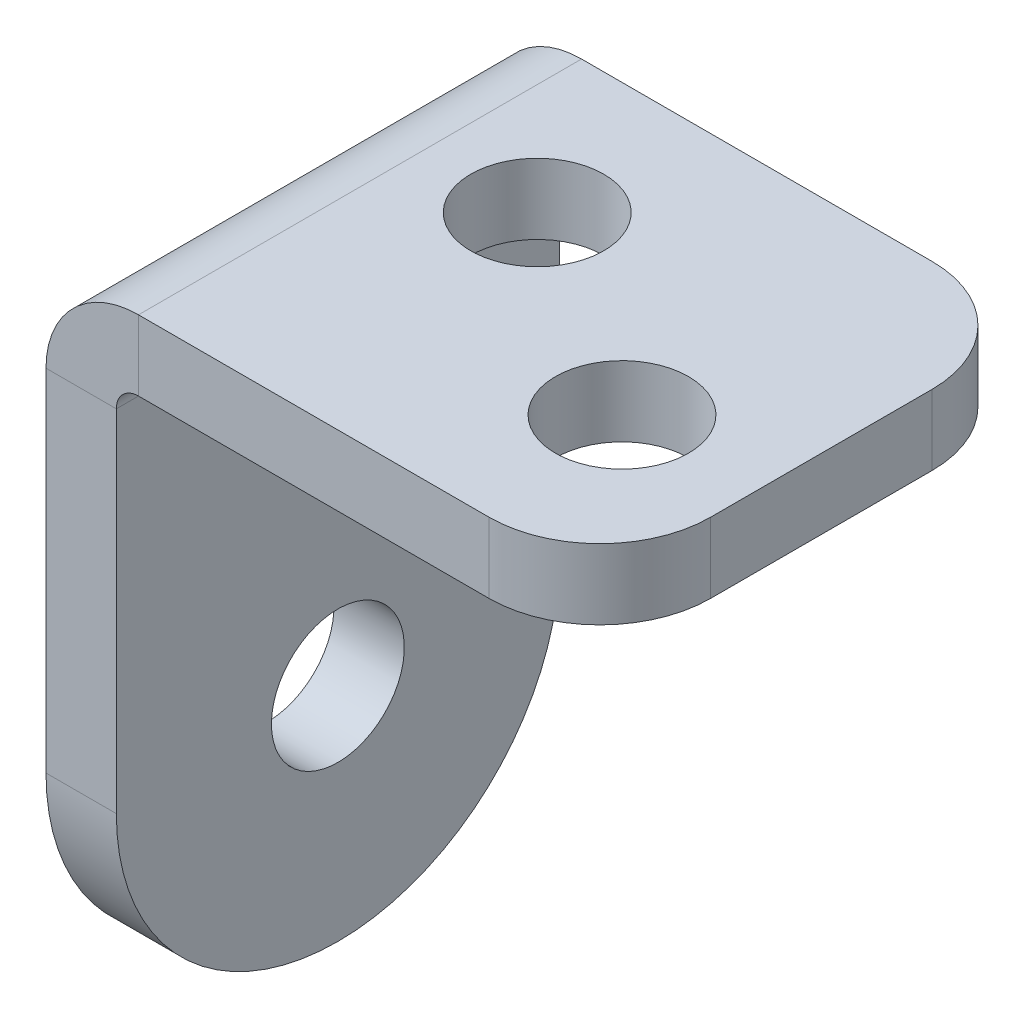
from build123d import *

# Parameters (mm, degrees)
BASE_FLANGE1_DEPTH = 20
SKETCH6_R          = 3
CUT_EXTRUDE1_DEPTH = 44.874821937
FILLET1_R          = 10
FILLET2_R          = 5
SKETCH7_R          = 3
CUT_EXTRUDE2_DEPTH = 42.768177181


# Read off the part's stored shape, not the designer's step: Base-Flange1
with BuildPart() as part:
    # Base-Flange1 outline → Base-Flange1 (new body)
    with BuildSketch(Plane.XY):
        with BuildLine():
            Line((4.175, 26.825), (25, 26.825))
            Line((25, 26.825), (25, 30))
            Line((25, 30), (4.175, 30))
            ThreePointArc((4.175, 30), (1.222829189, 28.777170811), (0, 25.825))
            Line((0, 25.825), (0, 0))
            Line((0, 0), (3.175, 0))
            Line((3.175, 0), (3.175, 25.825))
            ThreePointArc((3.175, 25.825), (3.467893219, 26.532106781), (4.175, 26.825))
        make_face()
    extrude(amount=BASE_FLANGE1_DEPTH)

    # Sketch6 → Cut-Extrude1 (cut, through all)
    with BuildSketch(Plane.ZY):
        with Locations((10, 10)):
            Circle(SKETCH6_R)
    extrude(amount=-CUT_EXTRUDE1_DEPTH, mode=Mode.SUBTRACT)

    # Fillet1
    fillet1_edges = [part.edges().sort_by_distance(p)[0] for p in [
        (1.5875, 0, 0),
        (1.5875, 0, 20),
    ]]
    fillet(fillet1_edges, radius=FILLET1_R - 0.0001)  # a hair under: the kernel refuses the full size

    # Fillet2
    fillet2_edges = [part.edges().sort_by_distance(p)[0] for p in [
        (25, 28.4125, 20),
        (25, 28.4125, 0),
    ]]
    fillet(fillet2_edges, radius=FILLET2_R)

    # Sketch7 → Cut-Extrude2 (cut, through all)
    with BuildSketch(Plane.XZ.offset(-26.825)):
        with Locations(Location((9.175, 7, 0), (0, 0, 270))):
            Circle(SKETCH7_R)
        with Locations(Location((19, 13, 0), (0, 0, 270))):
            Circle(SKETCH7_R)
    extrude(amount=-CUT_EXTRUDE2_DEPTH, mode=Mode.SUBTRACT)


solid = part.part
